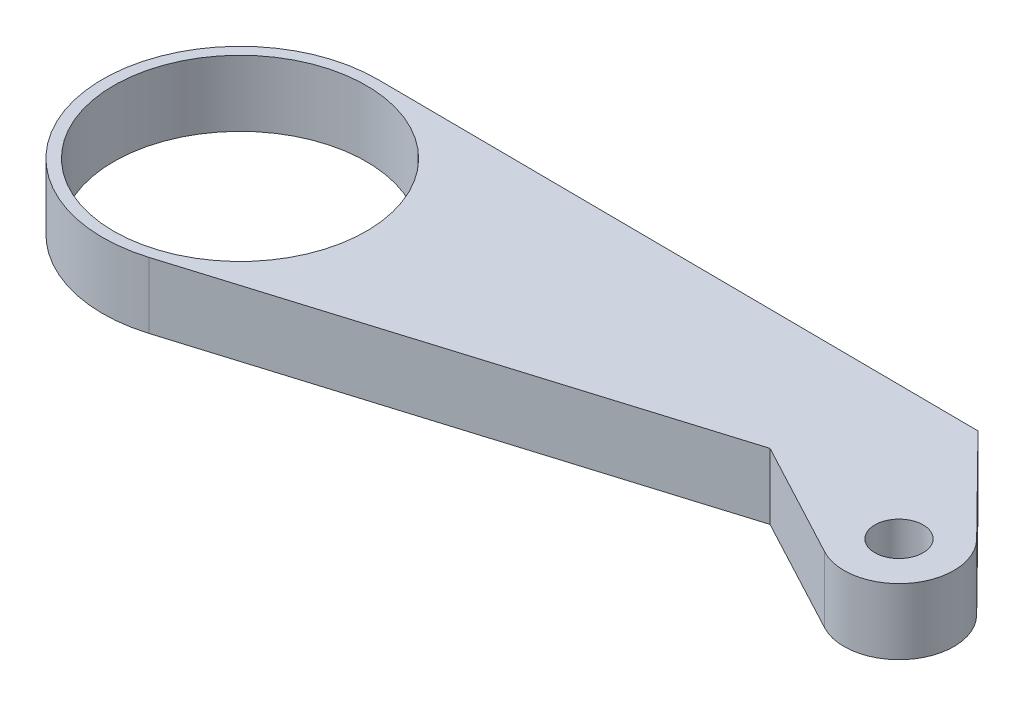
from build123d import *

# Parameters (mm, degrees)
SKETCH1_R           = 57.5
SKETCH1_R_2         = 11
BOSS_EXTRUDE2_DEPTH = 30


with BuildPart() as part:
    # Sketch1 → Boss-Extrude2 (new body)
    with BuildSketch(Plane(origin=(0, -40, 0), x_dir=(1, 0, 0), z_dir=(0, 1, 0))):
        with BuildLine():
            Line((275.432111298, 60.532518514), (0.446804363, 62.498402906))
            ThreePointArc((0.446804363, 62.498402906), (-61.849437084, -8.994283319), (18.229166667, -59.782501475))
            Line((18.229166667, -59.782501475), (234.977242992, 6.309360031))
            Line((234.977242992, 6.309360031), (288.24694207, -22.065031822))
            ThreePointArc((288.24694207, -22.065031822), (320.037630041, -14.949695059), (317.803593161, 17.550842446))
            Line((317.803593161, 17.550842446), (275.432111298, 60.532518514))
        make_face()
        Circle(SKETCH1_R, mode=Mode.SUBTRACT)
        with Locations((300, 0)):
            Circle(SKETCH1_R_2, mode=Mode.SUBTRACT)
    extrude(amount=BOSS_EXTRUDE2_DEPTH)


solid = part.part
